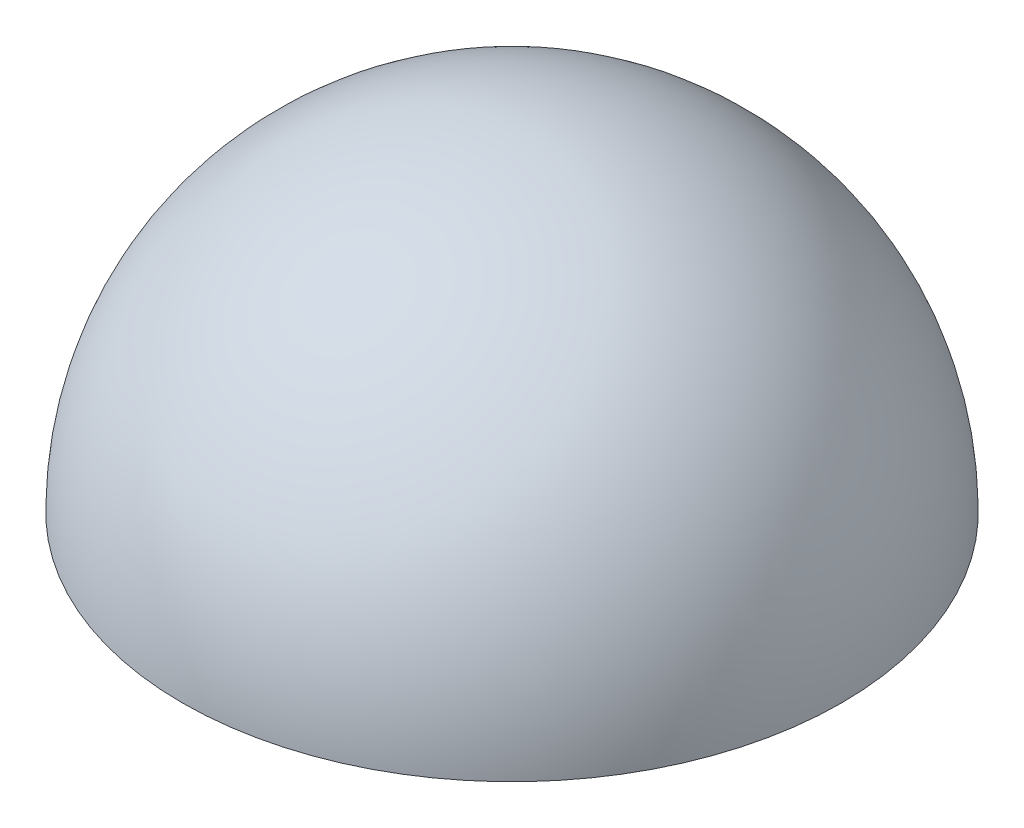
from build123d import *

# Parameters (mm, degrees)
AUFSATZ_LINEAR_AUSTRAGEN1_REACH = 62.622
SCHNITT_LINEAR_AUSTRAGEN1_DEPTH = 10
VERRUNDUNG4_R                   = 10


with BuildPart() as part:
    # Skizze1 → Rotation1 (revolve)
    with BuildSketch(Plane.XY):
        with BuildLine():
            Line((32, 0), (35, 0))
            ThreePointArc((35, 0), (24.748737342, 24.748737342), (0, 35))
            Line((0, 35), (0, 11.542689608))
            Line((0, 11.542689608), (29.845708512, 11.542689608))
            ThreePointArc((29.845708512, 11.542689608), (31.456817007, 5.871001942), (32, 0))
        make_face()
    revolve(axis=Axis((0, 35, 0), (0, -1, 0)))

    # Skizze2 → Aufsatz-Linear austragen1 (add, up to next)
    with BuildSketch(Plane(origin=(0, 0, 0), x_dir=(1, 0, 0), z_dir=(0, 1, 0)), mode=Mode.PRIVATE) as aufsatz_linear_austragen1_sk1:
        with BuildLine():
            ThreePointArc((6.00479212, 10.6), (5.1, 8.35), (6.00479212, 6.1))
            Line((6.00479212, 6.1), (10.69520788, 6.1))
            ThreePointArc((10.69520788, 6.1), (11.6, 8.35), (10.69520788, 10.6))
            Line((10.69520788, 10.6), (6.00479212, 10.6))
        make_face()
    aufsatz_linear_austragen1_tool1 = extrude(aufsatz_linear_austragen1_sk1.sketch, amount=AUFSATZ_LINEAR_AUSTRAGEN1_REACH, mode=Mode.PRIVATE) - part.part
    # Skizze2 → Aufsatz-Linear austragen1 (add, up to next)
    with BuildSketch(Plane(origin=(0, 0, 0), x_dir=(1, 0, 0), z_dir=(0, 1, 0)), mode=Mode.PRIVATE) as aufsatz_linear_austragen1_sk2:
        with BuildLine():
            Line((-10.69520788, 6.1), (-6.00479212, 6.1))
            ThreePointArc((-6.00479212, 6.1), (-5.1, 8.35), (-6.00479212, 10.6))
            Line((-6.00479212, 10.6), (-10.69520788, 10.6))
            ThreePointArc((-10.69520788, 10.6), (-11.6, 8.35), (-10.69520788, 6.1))
        make_face()
    aufsatz_linear_austragen1_tool2 = extrude(aufsatz_linear_austragen1_sk2.sketch, amount=AUFSATZ_LINEAR_AUSTRAGEN1_REACH, mode=Mode.PRIVATE) - part.part
    # Skizze2 → Aufsatz-Linear austragen1 (add, up to next)
    with BuildSketch(Plane(origin=(0, 0, 0), x_dir=(1, 0, 0), z_dir=(0, 1, 0)), mode=Mode.PRIVATE) as aufsatz_linear_austragen1_sk3:
        with BuildLine():
            ThreePointArc((-6.00479212, -10.6), (-5.1, -8.35), (-6.00479212, -6.1))
            Line((-6.00479212, -6.1), (-10.69520788, -6.1))
            ThreePointArc((-10.69520788, -6.1), (-11.6, -8.35), (-10.69520788, -10.6))
            Line((-10.69520788, -10.6), (-6.00479212, -10.6))
        make_face()
    aufsatz_linear_austragen1_tool3 = extrude(aufsatz_linear_austragen1_sk3.sketch, amount=AUFSATZ_LINEAR_AUSTRAGEN1_REACH, mode=Mode.PRIVATE) - part.part
    # Skizze2 → Aufsatz-Linear austragen1 (add, up to next)
    with BuildSketch(Plane(origin=(0, 0, 0), x_dir=(1, 0, 0), z_dir=(0, 1, 0)), mode=Mode.PRIVATE) as aufsatz_linear_austragen1_sk4:
        with BuildLine():
            Line((10.69520788, -6.1), (6.00479212, -6.1))
            ThreePointArc((6.00479212, -6.1), (5.1, -8.35), (6.00479212, -10.6))
            Line((6.00479212, -10.6), (10.69520788, -10.6))
            ThreePointArc((10.69520788, -10.6), (11.6, -8.35), (10.69520788, -6.1))
        make_face()
    aufsatz_linear_austragen1_tool4 = extrude(aufsatz_linear_austragen1_sk4.sketch, amount=AUFSATZ_LINEAR_AUSTRAGEN1_REACH, mode=Mode.PRIVATE) - part.part
    add(aufsatz_linear_austragen1_tool1.solids().sort_by_distance((8.35, 0, -8.35))[0])
    add(aufsatz_linear_austragen1_tool2.solids().sort_by_distance((-8.35, 0, -8.35))[0])
    add(aufsatz_linear_austragen1_tool3.solids().sort_by_distance((-8.35, 0, 8.35))[0])
    add(aufsatz_linear_austragen1_tool4.solids().sort_by_distance((8.35, 0, 8.35))[0])

    # Skizze2<3> → Schnitt-Linear austragen1 (cut)
    with BuildSketch(Plane(origin=(0, 0, 0), x_dir=(1, 0, 0), z_dir=(0, 1, 0))):
        Polygon((7.65, 7.65), (7.65, 6.1), (9.05, 6.1), (9.05, 7.65), (10.6, 7.65), (10.6, 9.05), (9.05, 9.05), (9.05, 10.6), (7.65, 10.6), (7.65, 9.05), (6.1, 9.05), (6.1, 7.65), align=None)
        Polygon((-10.6, 9.05), (-10.6, 7.65), (-9.05, 7.65), (-9.05, 6.1), (-7.65, 6.1), (-7.65, 7.65), (-6.1, 7.65), (-6.1, 9.05), (-7.65, 9.05), (-7.65, 10.6), (-9.05, 10.6), (-9.05, 9.05), align=None)
        Polygon((-7.65, -7.65), (-7.65, -6.1), (-9.05, -6.1), (-9.05, -7.65), (-10.6, -7.65), (-10.6, -9.05), (-9.05, -9.05), (-9.05, -10.6), (-7.65, -10.6), (-7.65, -9.05), (-6.1, -9.05), (-6.1, -7.65), align=None)
        Polygon((10.6, -9.05), (10.6, -7.65), (9.05, -7.65), (9.05, -6.1), (7.65, -6.1), (7.65, -7.65), (6.1, -7.65), (6.1, -9.05), (7.65, -9.05), (7.65, -10.6), (9.05, -10.6), (9.05, -9.05), align=None)
    extrude(amount=SCHNITT_LINEAR_AUSTRAGEN1_DEPTH, mode=Mode.SUBTRACT)

    # Verrundung4
    verrundung4_edges = [part.edges().sort_by_distance(p)[0] for p in [
        (-29.845708512, 11.542689608, 0),
    ]]
    fillet(verrundung4_edges, radius=VERRUNDUNG4_R)


solid = part.part
